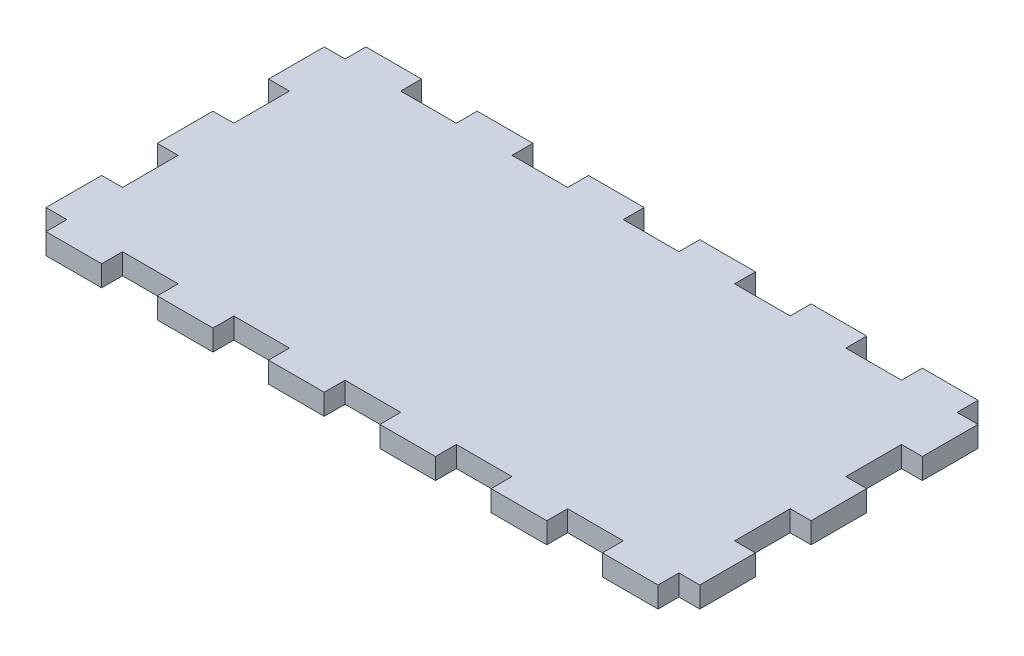
from build123d import *

# Parameters (mm, degrees)
SKETCH2_W               = 279.4
SKETCH2_H               = 127
BOSS_EXTRUDE1_DEPTH     = 9.525
SKETCH3_W               = 25.4
SKETCH3_H               = 9.525
BOSS_EXTRUDE2_DEPTH     = 9.525
LPATTERN1_COUNT         = 6
LPATTERN1_PITCH         = 50.8
MIRROR1_COPY_1_SKETCH_W = 25.4
MIRROR1_COPY_1_SKETCH_H = 9.525
MIRROR1_COPY_1_DEPTH    = 9.525
MIRROR1_COPY_2_SKETCH_W = 25.4
MIRROR1_COPY_2_SKETCH_H = 9.525
MIRROR1_COPY_2_DEPTH    = 9.525
MIRROR1_COPY_3_SKETCH_W = 25.4
MIRROR1_COPY_3_SKETCH_H = 9.525
MIRROR1_COPY_3_DEPTH    = 9.525
MIRROR1_COPY_4_SKETCH_W = 25.4
MIRROR1_COPY_4_SKETCH_H = 9.525
MIRROR1_COPY_4_DEPTH    = 9.525
MIRROR1_COPY_5_SKETCH_W = 25.4
MIRROR1_COPY_5_SKETCH_H = 9.525
MIRROR1_COPY_5_DEPTH    = 9.525
MIRROR1_COPY_6_SKETCH_W = 25.4
MIRROR1_COPY_6_SKETCH_H = 9.525
MIRROR1_COPY_6_DEPTH    = 9.525
SKETCH4_W               = 25.4
SKETCH4_H               = 9.525
BOSS_EXTRUDE3_DEPTH     = 9.525
LPATTERN2_COUNT         = 3
LPATTERN2_PITCH         = 50.8
MIRROR2_COPY_1_SKETCH_W = 25.4
MIRROR2_COPY_1_SKETCH_H = 9.525
MIRROR2_COPY_1_DEPTH    = 9.525
MIRROR2_COPY_2_SKETCH_W = 25.4
MIRROR2_COPY_2_SKETCH_H = 9.525
MIRROR2_COPY_2_DEPTH    = 9.525
MIRROR2_COPY_3_SKETCH_W = 25.4
MIRROR2_COPY_3_SKETCH_H = 9.525
MIRROR2_COPY_3_DEPTH    = 9.525


with BuildPart() as part:
    # Sketch2 → Boss-Extrude1 (new body)
    with BuildSketch(Plane(origin=(0, 0, 0), x_dir=(1, 0, 0), z_dir=(0, 1, 0))):
        Rectangle(SKETCH2_W, SKETCH2_H)
    extrude(amount=BOSS_EXTRUDE1_DEPTH)

    # Sketch3 → Boss-Extrude2 (add)
    with BuildSketch(Plane.XY.offset(63.5)):
        with Locations((-127, 4.7625)):
            Rectangle(SKETCH3_W, SKETCH3_H)
    boss_extrude2 = extrude(amount=BOSS_EXTRUDE2_DEPTH)

    # LPattern1: Boss-Extrude2 ×6
    with Locations(*[(i * LPATTERN1_PITCH, 0, 0) for i in range(1, LPATTERN1_COUNT)]):
        add(boss_extrude2)

    # Mirror1 copy 1 sketch → Mirror1 copy 1 (add)
    with BuildSketch(Plane(origin=(50.8, 0, -63.5), x_dir=(1, 0, 0), z_dir=(0, 0, -1))):
        with Locations((-127, -4.7625)):
            Rectangle(MIRROR1_COPY_1_SKETCH_W, MIRROR1_COPY_1_SKETCH_H)
    extrude(amount=MIRROR1_COPY_1_DEPTH)

    # Mirror1 copy 2 sketch → Mirror1 copy 2 (add)
    with BuildSketch(Plane(origin=(101.6, 0, -63.5), x_dir=(1, 0, 0), z_dir=(0, 0, -1))):
        with Locations((-127, -4.7625)):
            Rectangle(MIRROR1_COPY_2_SKETCH_W, MIRROR1_COPY_2_SKETCH_H)
    extrude(amount=MIRROR1_COPY_2_DEPTH)

    # Mirror1 copy 3 sketch → Mirror1 copy 3 (add)
    with BuildSketch(Plane(origin=(152.4, 0, -63.5), x_dir=(1, 0, 0), z_dir=(0, 0, -1))):
        with Locations((-127, -4.7625)):
            Rectangle(MIRROR1_COPY_3_SKETCH_W, MIRROR1_COPY_3_SKETCH_H)
    extrude(amount=MIRROR1_COPY_3_DEPTH)

    # Mirror1 copy 4 sketch → Mirror1 copy 4 (add)
    with BuildSketch(Plane(origin=(203.2, 0, -63.5), x_dir=(1, 0, 0), z_dir=(0, 0, -1))):
        with Locations((-127, -4.7625)):
            Rectangle(MIRROR1_COPY_4_SKETCH_W, MIRROR1_COPY_4_SKETCH_H)
    extrude(amount=MIRROR1_COPY_4_DEPTH)

    # Mirror1 copy 5 sketch → Mirror1 copy 5 (add)
    with BuildSketch(Plane(origin=(254, 0, -63.5), x_dir=(1, 0, 0), z_dir=(0, 0, -1))):
        with Locations((-127, -4.7625)):
            Rectangle(MIRROR1_COPY_5_SKETCH_W, MIRROR1_COPY_5_SKETCH_H)
    extrude(amount=MIRROR1_COPY_5_DEPTH)

    # Mirror1 copy 6 sketch → Mirror1 copy 6 (add)
    with BuildSketch(Plane(origin=(0, 0, -63.5), x_dir=(1, 0, 0), z_dir=(0, 0, -1))):
        with Locations((-127, -4.7625)):
            Rectangle(MIRROR1_COPY_6_SKETCH_W, MIRROR1_COPY_6_SKETCH_H)
    extrude(amount=MIRROR1_COPY_6_DEPTH)

    # Sketch4 → Boss-Extrude3 (add)
    with BuildSketch(Plane(origin=(139.7, 0, 0), x_dir=(0, 0, -1), z_dir=(1, 0, 0))):
        with Locations((-50.8, 4.7625)):
            Rectangle(SKETCH4_W, SKETCH4_H)
    boss_extrude3 = extrude(amount=BOSS_EXTRUDE3_DEPTH)

    # LPattern2: Boss-Extrude3 ×3
    with Locations(*[(0, 0, -i * LPATTERN2_PITCH) for i in range(1, LPATTERN2_COUNT)]):
        add(boss_extrude3)

    # Mirror2 copy 1 sketch → Mirror2 copy 1 (add)
    with BuildSketch(Plane(origin=(-139.7, 0, -50.8), x_dir=(0, 0, -1), z_dir=(-1, 0, 0))):
        with Locations((-50.8, -4.7625)):
            Rectangle(MIRROR2_COPY_1_SKETCH_W, MIRROR2_COPY_1_SKETCH_H)
    extrude(amount=MIRROR2_COPY_1_DEPTH)

    # Mirror2 copy 2 sketch → Mirror2 copy 2 (add)
    with BuildSketch(Plane(origin=(-139.7, 0, -101.6), x_dir=(0, 0, -1), z_dir=(-1, 0, 0))):
        with Locations((-50.8, -4.7625)):
            Rectangle(MIRROR2_COPY_2_SKETCH_W, MIRROR2_COPY_2_SKETCH_H)
    extrude(amount=MIRROR2_COPY_2_DEPTH)

    # Mirror2 copy 3 sketch → Mirror2 copy 3 (add)
    with BuildSketch(Plane(origin=(-139.7, 0, 0), x_dir=(0, 0, -1), z_dir=(-1, 0, 0))):
        with Locations((-50.8, -4.7625)):
            Rectangle(MIRROR2_COPY_3_SKETCH_W, MIRROR2_COPY_3_SKETCH_H)
    extrude(amount=MIRROR2_COPY_3_DEPTH)


solid = part.part
